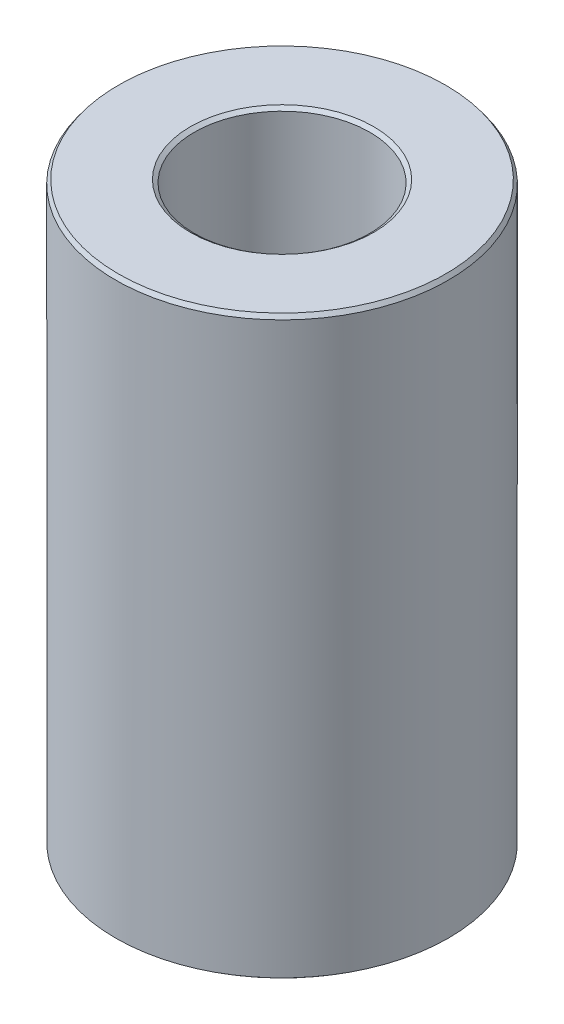
from build123d import *
from OCP.BRepFilletAPI import BRepFilletAPI_MakeChamfer

# Parameters (mm, degrees)
SKETCH1_R           = 57.5
BOSS_EXTRUDE1_DEPTH = 199.226242425
SKETCH2_R           = 30.316216491
CUT_EXTRUDE1_DEPTH  = 216.182703001
CHAMFER1_SIZE       = 1.352707749
CHAMFER1_SIZE2      = 0.98195083


with BuildPart() as part:
    # Sketch1 → Boss-Extrude1 (new body)
    with BuildSketch(Plane(origin=(0, 0, 0), x_dir=(1, 0, 0), z_dir=(0, 1, 0))):
        Circle(SKETCH1_R)
    extrude(amount=BOSS_EXTRUDE1_DEPTH)

    # Sketch2 → Cut-Extrude1 (cut, through all)
    with BuildSketch(Plane(origin=(0, 0, 0), x_dir=(1, 0, 0), z_dir=(0, 1, 0))):
        Circle(SKETCH2_R)
    extrude(amount=CUT_EXTRUDE1_DEPTH, mode=Mode.SUBTRACT)

    # Chamfer1: one chamfer whose edges measure the first distance from different faces: ONE call of the kernel's chamfer builder (chamfer() names one face for all edges)
    chamfer1_edges_1 = [part.edges().sort_by_distance(p)[0] for p in [
        (-30.316216491, 199.226242425, 0),
    ]]
    chamfer1_side_1 = [part.faces().sort_by_distance(p)[0] for p in [
        (-55.873654403, 199.226242425, 0),
    ]]
    chamfer1_edges_2 = [part.edges().sort_by_distance(p)[0] for p in [
        (-30.316216491, 0, 0),
    ]]
    chamfer1_side_2 = [part.faces().sort_by_distance(p)[0] for p in [
        (-30.316216491, 99.613121212, 0),
    ]]
    chamfer1_edges_3 = [part.edges().sort_by_distance(p)[0] for p in [
        (-57.5, 0, 0),
    ]]
    chamfer1_side_3 = [part.faces().sort_by_distance(p)[0] for p in [
        (-55.873654403, 0, 0),
    ]]
    chamfer1_edges_4 = [part.edges().sort_by_distance(p)[0] for p in [
        (-57.5, 199.226242425, 0),
    ]]
    chamfer1_side_4 = [part.faces().sort_by_distance(p)[0] for p in [
        (-57.5, 99.613121212, 0),
    ]]
    chamfer1 = BRepFilletAPI_MakeChamfer(part.part.solid().wrapped)
    for e in chamfer1_edges_1:
        chamfer1.Add(CHAMFER1_SIZE, CHAMFER1_SIZE2, e.wrapped, chamfer1_side_1[0].wrapped)  # the first distance lies on this face
    for e in chamfer1_edges_2:
        chamfer1.Add(CHAMFER1_SIZE, CHAMFER1_SIZE2, e.wrapped, chamfer1_side_2[0].wrapped)  # the first distance lies on this face
    for e in chamfer1_edges_3:
        chamfer1.Add(CHAMFER1_SIZE, CHAMFER1_SIZE2, e.wrapped, chamfer1_side_3[0].wrapped)  # the first distance lies on this face
    for e in chamfer1_edges_4:
        chamfer1.Add(CHAMFER1_SIZE, CHAMFER1_SIZE2, e.wrapped, chamfer1_side_4[0].wrapped)  # the first distance lies on this face
    add(Compound.cast(chamfer1.Shape()), mode=Mode.REPLACE)


solid = part.part
